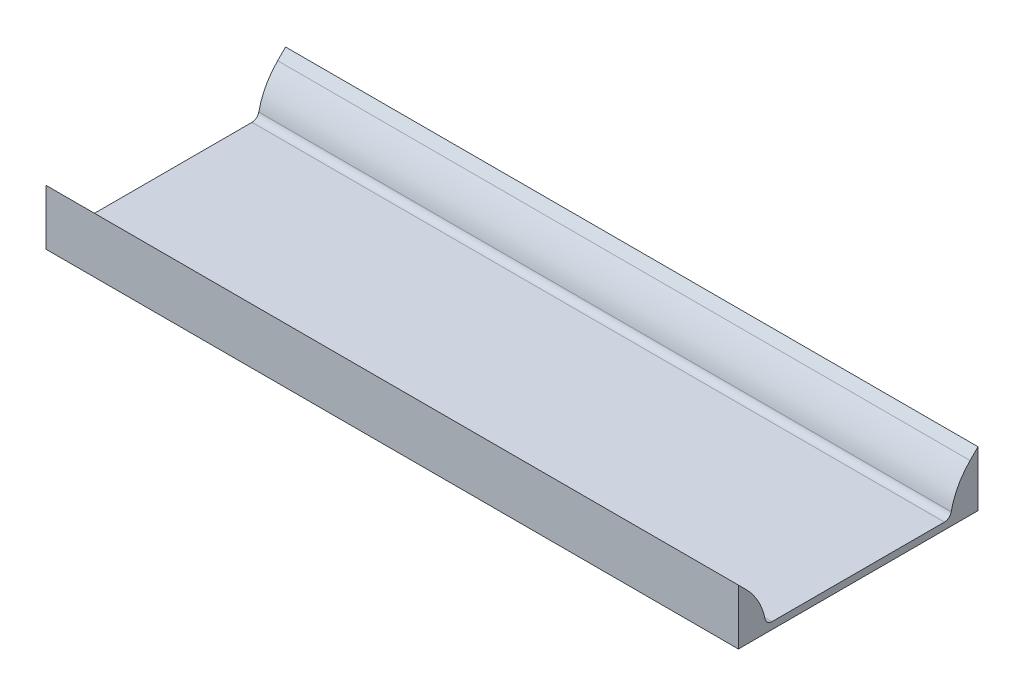
from build123d import *

# Parameters (mm, degrees)
SKETCH1_W           = 127
SKETCH1_H           = 43.942
BOSS_EXTRUDE1_DEPTH = 10.16
SKETCH2_W           = 114.3
SKETCH2_H           = 33.782
SKETCH2_W_2         = 6.35
CUT_EXTRUDE1_DEPTH  = 8.89
CHAMFER1_SIZE       = 5.08
FILLET1_R           = 12.7
FILLET2_R           = 1.27


# Some blends are built 0.0001 mm under size
with BuildPart() as part:
    # Sketch1 → Boss-Extrude1 (new body)
    with BuildSketch(Plane(origin=(0, 0, 0), x_dir=(1, 0, 0), z_dir=(0, 1, 0))):
        Rectangle(SKETCH1_W, SKETCH1_H)
    extrude(amount=BOSS_EXTRUDE1_DEPTH)

    # Sketch2 → Cut-Extrude1 (cut)
    with BuildSketch(Plane(origin=(0, 10.16, 0), x_dir=(1, 0, 0), z_dir=(0, 1, 0))):
        Rectangle(SKETCH2_W, SKETCH2_H)
        with Locations((60.325, 0)):
            Rectangle(SKETCH2_W_2, SKETCH2_H)
        with Locations((-60.325, 0)):
            Rectangle(SKETCH2_W_2, SKETCH2_H)
    extrude(amount=-CUT_EXTRUDE1_DEPTH, mode=Mode.SUBTRACT)

    # Chamfer1
    chamfer1_edges = [part.edges().sort_by_distance(p)[0] for p in [
        (0, 10.16, 16.891),
        (0, 10.16, -16.891),
    ]]
    chamfer(chamfer1_edges, length=CHAMFER1_SIZE - 0.0001)  # a hair under: the kernel refuses the full size

    # Fillet1
    # the kernel refuses this fillet: 12.7 mm, written as the material it takes off along each edge
    with BuildSketch(Plane(origin=(76.317910379, 5.0801, 16.891), x_dir=(0, -1, 0), z_dir=(-1, 0, 0))) as fillet1_piece_1:
        with BuildLine():
            CenterArc((5.354803581, 12.605708661), FILLET1_R, 225, 38.013804416)
            Line((-3.62545254, 3.62545254), (-3.805057662, 3.445847418))
            Line((-3.805057662, 3.445847418), (-0.179605122, -0.179605122))
            Line((-0.179605122, -0.179605122), (0, -0.254))
            ThreePointArc((0, -0.254), (1.90505, -0.254), (3.779205928, -0.252114173))
            Line((3.779205928, -0.252114173), (3.8101, 0))
        make_face()
    extrude(amount=152.635820759, mode=Mode.SUBTRACT)
    with BuildSketch(Plane(origin=(76.317910379, 5.0801, -16.891), x_dir=(0, 0.7071067811865474, -0.7071067811865477), z_dir=(-1, 0, 0))) as fillet1_piece_2:
        with BuildLine():
            CenterArc((5.127164152, 12.7), FILLET1_R, 231.986195584, 38.013804416)
            Line((-2.694147547, 2.694147547), (-2.850573781, 2.494030498))
            ThreePointArc((-2.850573781, 2.494030498), (-1.526678896, 1.167468651), (-0.179605122, -0.179605122))
            Line((-0.179605122, -0.179605122), (0, -0.254))
            Line((0, -0.254), (5.127164152, -0.254))
            Line((5.127164152, -0.254), (5.127164152, 0))
        make_face()
    extrude(amount=152.635820759, mode=Mode.SUBTRACT)

    # Fillet2
    fillet2_edges = [part.edges().sort_by_distance(p)[0] for p in [
        (0, 1.27, 16.891),
        (0, 1.27, -16.891),
    ]]
    fillet(fillet2_edges, radius=FILLET2_R)


solid = part.part
